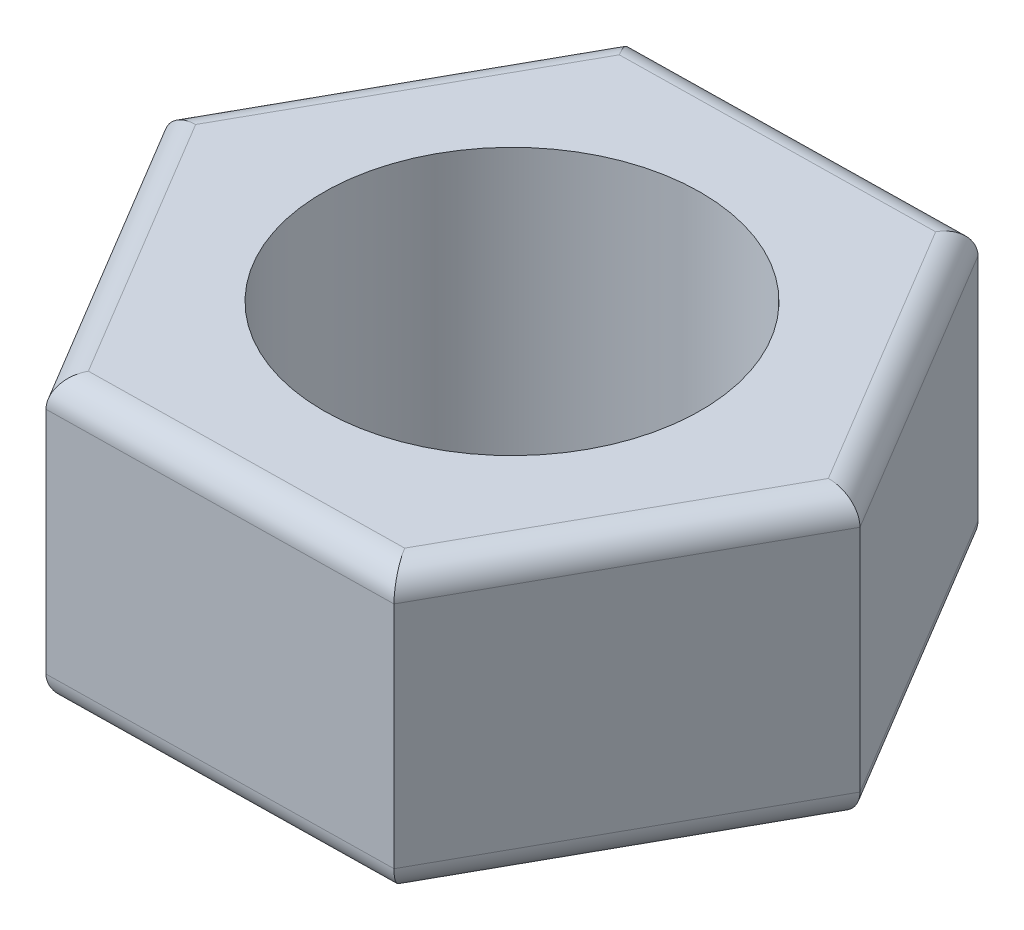
from build123d import *

# Parameters (mm, degrees)
SKETCH_1_R      = 7
EXTRUDE_1_DEPTH = 10.5
FILLET_1_R      = 1


with BuildPart() as part:
    # Эскиз1 → Вытянуть1 (new body)
    with BuildSketch(Plane(origin=(0, 0, 0), x_dir=(1, 0, 0), z_dir=(0, 1, 0))):
        Polygon((6.523683625, -10.898389115), (12.700123646, 0.200481188), (6.176440021, 11.098870303), (-6.523683625, 10.898389115), (-12.700123646, -0.200481188), (-6.176440021, -11.098870303), align=None)
        Circle(SKETCH_1_R, mode=Mode.SUBTRACT)
    extrude(amount=EXTRUDE_1_DEPTH)

    # Скругление1
    fillet_1_edges = [part.edges().sort_by_distance(p)[0] for p in [
        (-9.438281834, 0, 5.649675745),
        (-9.611903636, 0, -5.348953963),
        (-0.173621802, 0, -10.998629709),
        (9.438281834, 0, -5.649675745),
        (9.611903636, 0, 5.348953963),
        (0.173621802, 0, 10.998629709),
        (-9.438281834, 10.5, 5.649675745),
        (-9.611903636, 10.5, -5.348953963),
        (-0.173621802, 10.5, -10.998629709),
        (9.438281834, 10.5, -5.649675745),
        (9.611903636, 10.5, 5.348953963),
        (0.173621802, 10.5, 10.998629709),
    ]]
    fillet(fillet_1_edges, radius=FILLET_1_R)


solid = part.part
